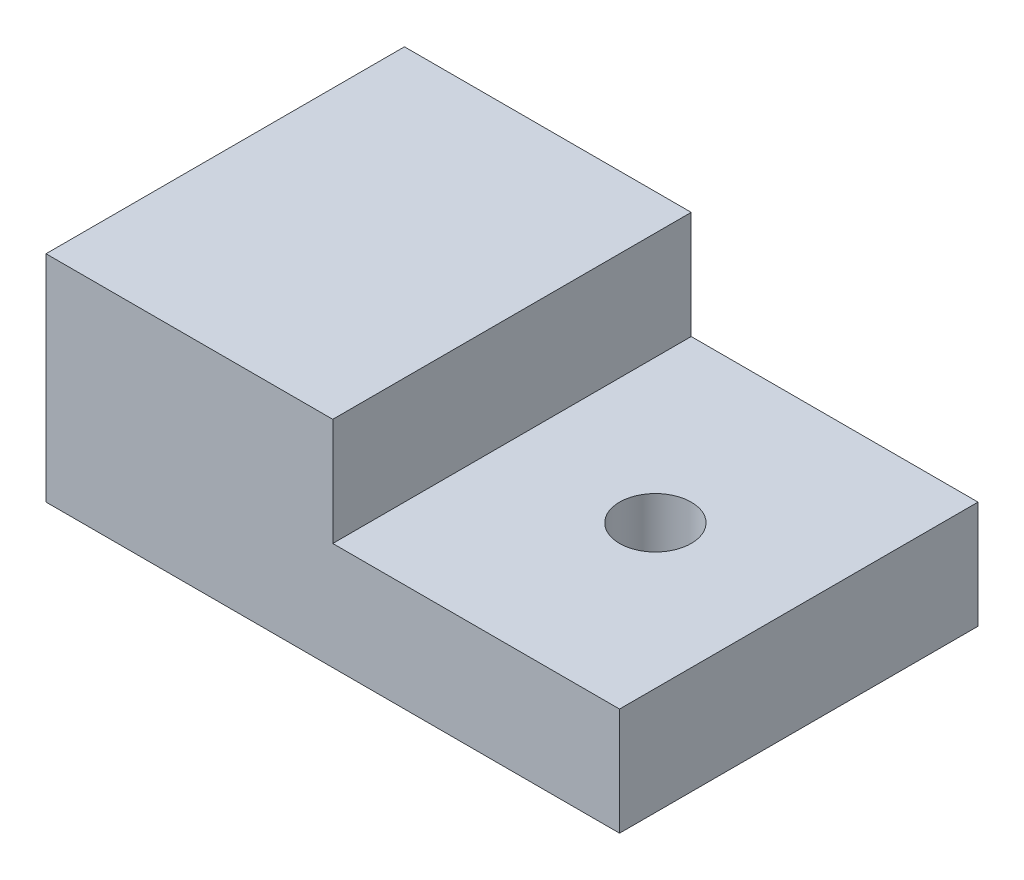
from build123d import *

# Parameters (mm, degrees)
EXTRUDE_START       = -25
EXTRUDE_1_DEPTH     = 50
SKETCH_2_R          = 5
CUT_EXTRUDE_1_DEPTH = 8


# Read off the part's stored shape, not the designer's step: 凸台-拉伸1
with BuildPart() as part:
    # 凸台-拉伸1 outline → 凸台-拉伸1 (new body)
    with BuildSketch(Plane.XY.offset(EXTRUDE_START)):
        Polygon((-40, 30), (-40, 0), (40, 0), (40, 15), (0, 15), (0, 30), align=None)
    extrude(amount=EXTRUDE_1_DEPTH)

    # 草图2 → 切除-拉伸1 (cut)
    with BuildSketch(Plane(origin=(0, 15, 0), x_dir=(1, 0, 0), z_dir=(0, 1, 0))):
        with Locations(Location((20, 0, 0), (0, 0, 270))):
            Circle(SKETCH_2_R)
    extrude(amount=-CUT_EXTRUDE_1_DEPTH, mode=Mode.SUBTRACT)


solid = part.part
